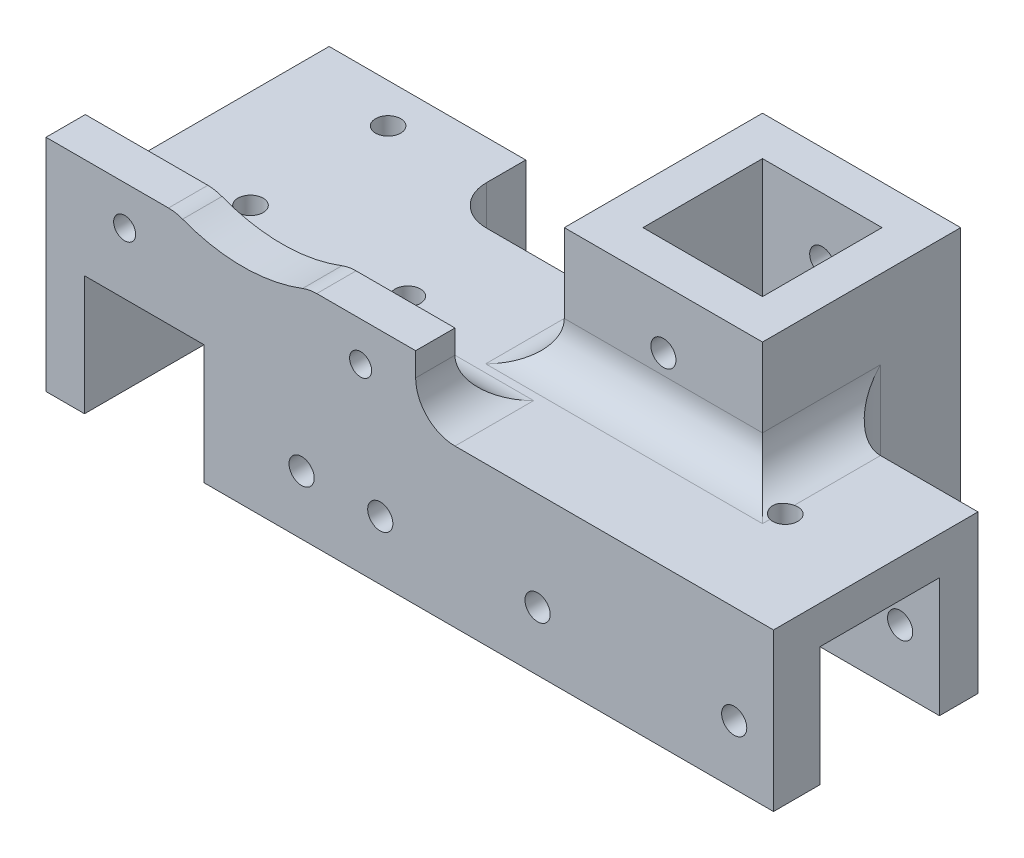
from build123d import *

# Parameters (mm, degrees)
SKETCH_1_W               = 15.2
SKETCH_1_H               = 15.2
EXTRUDE_1_DEPTH          = 20
SKETCH_2_W               = 25.2
SKETCH_2_H               = 25.2
SKETCH_2_W_2             = 15.2
SKETCH_2_H_2             = 15.2
EXTRUDE_2_DEPTH          = 15
SKETCH_3_W               = 15.2
SKETCH_3_H               = 15.2
CUT_EXTRUDE_1_DEPTH      = 80
SKETCH_4_R               = 1.6
CUT_EXTRUDE_2_DEPTH      = 83.635888087
FILLET_1_R               = 5
SKETCH_5_W               = 15.2
SKETCH_5_H               = 15.2
CUT_EXTRUDE_3_DEPTH      = 83.635888087
CUT_EXTRUDE_5_DEPTH      = 72.228786316
CUT_EXTRUDE_5_DEPTH_BACK = 72.228786316
SKETCH_7_R               = 1.6
SKETCH_8_W               = 47
SKETCH_8_H               = 5
EXTRUDE_3_DEPTH          = 8
CUT_EXTRUDE_6_REACH      = 84.636
SKETCH_9_R               = 21.25
SKETCH_9_R_2             = 1.4
FILLET_2_R               = 5


with BuildPart() as part:
    # 草图1 → 凸台-拉伸1 (new body)
    with BuildSketch(Plane(origin=(0, 0, 0), x_dir=(1, 0, 0), z_dir=(0, 1, 0))):
        Polygon((-37.5, 12.5), (-12.6, 12.5), (-12.6, 27.7), (12.6, 27.7), (12.6, 12.5), (30, 12.5), (30, -13.5), (-62.5, -13.5), (-62.5, 22.5), (-37.5, 22.5), align=None)
        with Locations((0, 15.1)):
            Rectangle(SKETCH_1_W, SKETCH_1_H, mode=Mode.SUBTRACT)
    extrude(amount=EXTRUDE_1_DEPTH)

    # 草图2 → 凸台-拉伸2 (add)
    with BuildSketch(Plane(origin=(0, 20, 0), x_dir=(1, 0, 0), z_dir=(0, 1, 0))):
        with Locations((0, 15.1)):
            Rectangle(SKETCH_2_W, SKETCH_2_H)
        with Locations((0, 15.1)):
            Rectangle(SKETCH_2_W_2, SKETCH_2_H_2, mode=Mode.SUBTRACT)
    extrude(amount=EXTRUDE_2_DEPTH)

    # 草图3 → 切除-拉伸1 (cut)
    with BuildSketch(Plane(origin=(30, 0, 0), x_dir=(0, 0, -1), z_dir=(1, 0, 0))):
        with Locations((0, 7.6)):
            Rectangle(SKETCH_3_W, SKETCH_3_H)
    extrude(amount=-CUT_EXTRUDE_1_DEPTH, mode=Mode.SUBTRACT)

    # 草图4 → 切除-拉伸2 (cut, through all)
    with BuildSketch(Plane.XY.offset(13.5)):
        with Locations((0, 7.5)):
            Circle(SKETCH_4_R)
        with Locations((25, 7.5)):
            Circle(SKETCH_4_R)
        with Locations((-20, 7.5)):
            Circle(SKETCH_4_R)
        with Locations((0, 27.5)):
            Circle(SKETCH_4_R)
        with Locations((-30, 7.5)):
            Circle(SKETCH_4_R)
    extrude(amount=-CUT_EXTRUDE_2_DEPTH, mode=Mode.SUBTRACT)

    # 圆角1
    fillet_1_edges = [part.edges().sort_by_distance(p)[0] for p in [
        (-37.5, 10, -12.5),
        (-12.6, 10, -12.5),
        (12.6, 10, -12.5),
        (-12.6, 20, -7.5),
        (0, 20, -2.5),
        (12.6, 20, -7.5),
    ]]
    fillet(fillet_1_edges, radius=FILLET_1_R)

    # 草图5 → 切除-拉伸3 (cut, through all)
    with BuildSketch(Plane.XY.offset(13.5)):
        with Locations((-50, 7.6)):
            Rectangle(SKETCH_5_W, SKETCH_5_H)
    extrude(amount=-CUT_EXTRUDE_3_DEPTH, mode=Mode.SUBTRACT)

    # 草图7 → 切除-拉伸5 (cut, two sides: drawn at the far end of the back side and taken through both)
    with BuildSketch(Plane(origin=(0, 20, 0), x_dir=(1, 0, 0), z_dir=(0, 1, 0)).offset(-CUT_EXTRUDE_5_DEPTH_BACK)):
        with Locations(Location((-50, 0, 0), (0, 0, 270))):
            Circle(SKETCH_7_R)
        with Locations(Location((-30, 0, 0), (0, 0, 270))):
            Circle(SKETCH_7_R)
        with Locations(Location((18, 0, 0), (0, 0, 270))):
            Circle(SKETCH_7_R)
        with Locations(Location((-50, 17.5, 0), (0, 0, 270))):
            Circle(SKETCH_7_R)
    extrude(amount=CUT_EXTRUDE_5_DEPTH + CUT_EXTRUDE_5_DEPTH_BACK, mode=Mode.SUBTRACT)

    # 草图8 → 凸台-拉伸3 (add)
    with BuildSketch(Plane(origin=(0, 20, 0), x_dir=(1, 0, 0), z_dir=(0, 1, 0))):
        with Locations((-39, -11)):
            Rectangle(SKETCH_8_W, SKETCH_8_H)
    extrude(amount=EXTRUDE_3_DEPTH)

    # 草图9 → 切除-拉伸6 (cut, up to next)
    with BuildSketch(Plane.XY.offset(13.5), mode=Mode.PRIVATE) as cut_extrude_6_sk1:
        with Locations((-37.5, 47.5)):
            Circle(SKETCH_9_R)
    cut_extrude_6_tool1 = extrude(cut_extrude_6_sk1.sketch, amount=-CUT_EXTRUDE_6_REACH, mode=Mode.PRIVATE) & part.part
    # 草图9 → 切除-拉伸6 (cut, up to next)
    with BuildSketch(Plane.XY.offset(13.5), mode=Mode.PRIVATE) as cut_extrude_6_sk2:
        with Locations((-52.5, 23)):
            Circle(SKETCH_9_R_2)
    cut_extrude_6_tool2 = extrude(cut_extrude_6_sk2.sketch, amount=-CUT_EXTRUDE_6_REACH, mode=Mode.PRIVATE) & part.part
    # 草图9 → 切除-拉伸6 (cut, up to next)
    with BuildSketch(Plane.XY.offset(13.5), mode=Mode.PRIVATE) as cut_extrude_6_sk3:
        with Locations((-22.5, 23)):
            Circle(SKETCH_9_R_2)
    cut_extrude_6_tool3 = extrude(cut_extrude_6_sk3.sketch, amount=-CUT_EXTRUDE_6_REACH, mode=Mode.PRIVATE) & part.part
    add(cut_extrude_6_tool1.solids().sort_by_distance((-37.5, 47.5, 13.5))[0], mode=Mode.SUBTRACT)
    add(cut_extrude_6_tool2.solids().sort_by_distance((-52.5, 23, 13.5))[0], mode=Mode.SUBTRACT)
    add(cut_extrude_6_tool3.solids().sort_by_distance((-22.5, 23, 13.5))[0], mode=Mode.SUBTRACT)

    # 圆角2
    # the kernel refuses this fillet: 5 mm, written as the material it adds along each edge
    with BuildSketch(Plane(origin=(-15.5, 20, 13.5), x_dir=(1, 0, 0), z_dir=(0, 0, -1))) as fillet_2_piece_1:
        with BuildLine():
            CenterArc((FILLET_2_R, -FILLET_2_R), FILLET_2_R, 90, 90)
            Line((0, -FILLET_2_R), (0, 0))
            Line((0, 0), (FILLET_2_R, 0))
        make_face()
    extrude(amount=5)
    with BuildSketch(Plane(origin=(-15.5, 20, 8.5), x_dir=(0, 0, -1), z_dir=(-1, 0, 0))) as fillet_2_piece_2_section:
        with BuildLine():
            CenterArc((FILLET_2_R, -FILLET_2_R), FILLET_2_R, 90, 90)
            Line((0, -FILLET_2_R), (0, 0))
            Line((0, 0), (FILLET_2_R, 0))
        make_face()
    fillet_2_piece_2 = extrude(amount=47, mode=Mode.PRIVATE)
    fillet_2_piece_2 = fillet_2_piece_2 - Plane(origin=(-22.5, 23, 7.347121569), x_dir=(1, 0, 0), z_dir=(0, 0, 1)) * Cylinder(1.4, 114, mode=Mode.PRIVATE)
    fillet_2_piece_2 = fillet_2_piece_2 - Plane(origin=(-52.5, 23, 7.347121569), x_dir=(1, 0, 0), z_dir=(0, 0, 1)) * Cylinder(1.4, 114, mode=Mode.PRIVATE)
    add(fillet_2_piece_2)
    with BuildSketch(Plane(origin=(-3, 20, 8.5), x_dir=(0, 0, -1), z_dir=(-1, 0, 0))) as fillet_2_piece_3a_section:
        with BuildLine():
            CenterArc((FILLET_2_R, -FILLET_2_R), FILLET_2_R, 90, 90)
            Line((0, -FILLET_2_R), (0, 0))
            Line((0, 0), (FILLET_2_R, 0))
        make_face()
    fillet_2_piece_3a = extrude(amount=59.5, mode=Mode.PRIVATE)
    fillet_2_piece_3a = split(fillet_2_piece_3a, bisect_by=Plane(origin=(-15.5, 21.131975571, 7.368024429), z_dir=(1, 0, 0)), keep=Keep.TOP, mode=Mode.PRIVATE)
    with BuildSketch(Plane(origin=(-15.5, 20, 13.5), x_dir=(1, 0, 0), z_dir=(0, 0, -1))) as fillet_2_piece_3b_section:
        with BuildLine():
            CenterArc((FILLET_2_R, -FILLET_2_R), FILLET_2_R, 90, 90)
            Line((0, -FILLET_2_R), (0, 0))
            Line((0, 0), (FILLET_2_R, 0))
        make_face()
    fillet_2_piece_3b = extrude(amount=17.5, mode=Mode.PRIVATE)
    fillet_2_piece_3b = split(fillet_2_piece_3b, bisect_by=Plane(origin=(-14.368024429, 21.131975571, 8.5), z_dir=(0, 0, -1)), keep=Keep.TOP, mode=Mode.PRIVATE)
    fillet_2_piece_3 = fillet_2_piece_3a & fillet_2_piece_3b
    add(fillet_2_piece_3)
    # the kernel refuses this fillet: 5 mm, written as the material it takes off along each edge
    with BuildSketch(Plane(origin=(-29.055327123, 28, 6.051586161), x_dir=(-0.9256891824228564, -0.378284995136344, 0), z_dir=(0, 0, 1))) as fillet_2_2_piece_1:
        with BuildLine():
            CenterArc((0.984836894, 4.998925199), FILLET_2_R, 247.772508302, 21.039469781)
            Line((-0.906588082, 0.370479287), (0, 0))
            ThreePointArc((0, 0), (0.440584926, 0.004567905), (0.881169852, 0))
        make_face()
    extrude(amount=9.896827677, mode=Mode.SUBTRACT)
    with BuildSketch(Plane(origin=(-45.944672877, 28, 6.051586161), x_dir=(-1, 0, 0), z_dir=(0, 0, 1))) as fillet_2_2_piece_2:
        with BuildLine():
            CenterArc((0.979365535, 5), FILLET_2_R, 248.960530219, 21.039469781)
            ThreePointArc((-0.8156894, 0.333333333), (-0.40611673, 0.170895126), (0, 0))
            Line((0, 0), (0.979365535, 0))
        make_face()
    extrude(amount=9.896827677, mode=Mode.SUBTRACT)


solid = part.part
